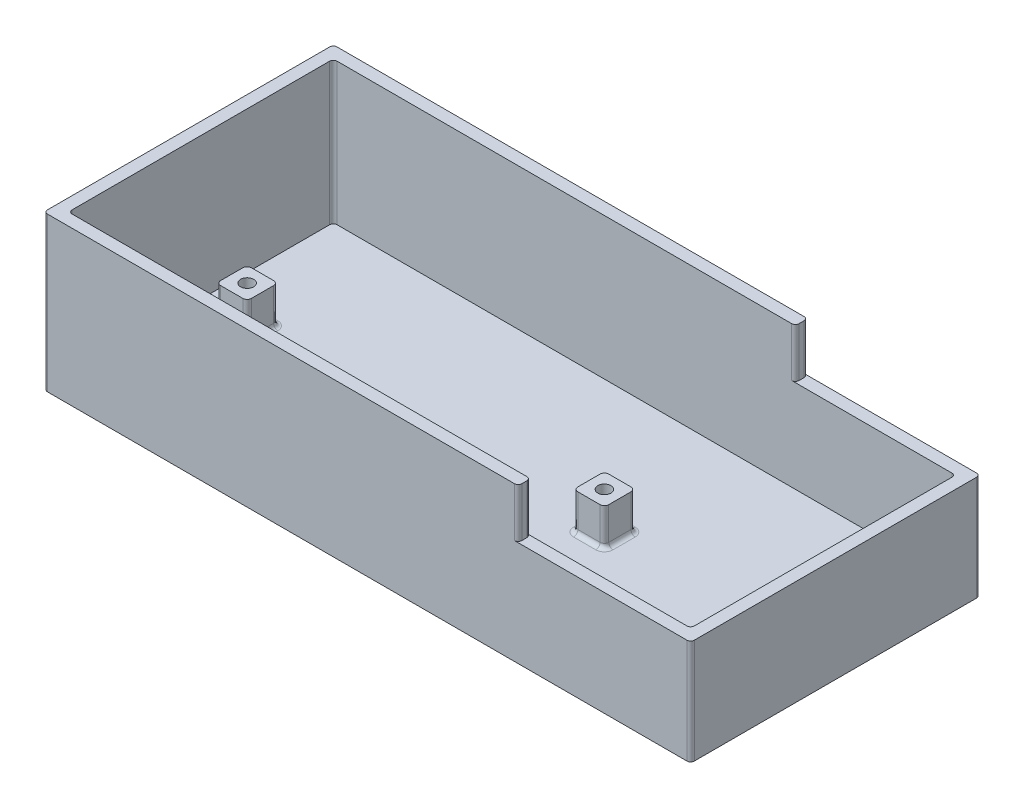
from build123d import *

# Parameters (mm, degrees)
SKETCH1_W           = 97.79
SKETCH1_H           = 59.69
BOSS_EXTRUDE1_DEPTH = 31.75
SHELL1_T            = -2.54
SKETCH2_W           = 6.35
SKETCH2_H           = 6.35
SKETCH2_R           = 1.35
BOSS_EXTRUDE2_DEPTH = 7.62
FILLET2_R           = 0.889
BOSS_EXTRUDE3_DEPTH = 35.56
SHELL2_START        = 2.54
SHELL2_OUTLINE_W    = 33.02
SHELL2_OUTLINE_H    = 54.61
SHELL2_DEPTH        = 19.05
FILLET3_R           = 0.762


# Read off the part's stored shape, not the designer's step: Shell2
with BuildPart() as part:
    # Sketch1 → Boss-Extrude1 (new body)
    with BuildSketch(Plane(origin=(0, 0, 0), x_dir=(1, 0, 0), z_dir=(0, 1, 0))):
        Rectangle(SKETCH1_W, SKETCH1_H)
    extrude(amount=BOSS_EXTRUDE1_DEPTH)

    # Shell1
    shell1_openings = [part.faces().sort_by_distance(p)[0] for p in [
        (0, 31.75, 0),
        (48.895, 15.875, 0),
    ]]
    offset(amount=SHELL1_T, openings=shell1_openings, kind=Kind.INTERSECTION)

    # Sketch2 → Boss-Extrude2 (add)
    # profile 1 of 2: a face of its own
    with BuildSketch(Plane(origin=(0, 2.54, 0), x_dir=(1, 0, 0), z_dir=(0, 1, 0))):
        with Locations((-36.83, 0)):
            Rectangle(SKETCH2_W, SKETCH2_H)
        with Locations(Location((-36.83, 0, 0), (0, 0, 90))):
            Circle(SKETCH2_R, mode=Mode.SUBTRACT)
    # profile 2 of 2: a face of its own
    with BuildSketch(Plane(origin=(0, 2.54, 0), x_dir=(1, 0, 0), z_dir=(0, 1, 0))):
        with Locations((36.83, 0)):
            Rectangle(SKETCH2_W, SKETCH2_H)
        with Locations(Location((36.83, 0, 0), (0, 0, 90))):
            Circle(SKETCH2_R, mode=Mode.SUBTRACT)
    extrude(amount=BOSS_EXTRUDE2_DEPTH)

    # Fillet2
    fillet2_edges = [part.edges().sort_by_distance(p)[0] for p in [
        (-33.655, 2.54, 0),
        (-33.655, 6.35, 3.175),
        (-36.83, 2.54, -3.175),
        (-33.655, 6.35, -3.175),
        (-40.005, 2.54, 0),
        (-40.005, 6.35, -3.175),
        (-36.83, 2.54, 3.175),
        (-40.005, 6.35, 3.175),
        (33.655, 2.54, 0),
        (33.655, 6.35, -3.175),
        (36.83, 2.54, 3.175),
        (33.655, 6.35, 3.175),
        (40.005, 2.54, 0),
        (40.005, 6.35, 3.175),
        (36.83, 2.54, -3.175),
        (40.005, 6.35, -3.175),
    ]]
    fillet(fillet2_edges, radius=FILLET2_R)

    # Sketch4 → Boss-Extrude3 (add)
    with BuildSketch(Plane(origin=(48.895, 0, 0), x_dir=(0, 0, -1), z_dir=(1, 0, 0))):
        Polygon((-29.845, 21.59), (-27.305, 21.59), (27.305, 21.59), (29.845, 21.59), (29.845, 0), (-29.845, 0), align=None)
    extrude(amount=BOSS_EXTRUDE3_DEPTH)

    # Shell2 outline → Shell2 (cut)
    with BuildSketch(Plane(origin=(0, 0, 0), x_dir=(1, 0, 0), z_dir=(0, 1, 0)).offset(SHELL2_START)):
        with Locations((65.405, 0)):
            Rectangle(SHELL2_OUTLINE_W, SHELL2_OUTLINE_H)
    extrude(amount=SHELL2_DEPTH, mode=Mode.SUBTRACT)

    # Fillet3
    fillet3_edges = [part.edges().sort_by_distance(p)[0] for p in [
        (84.455, 10.795, 29.845),
        (84.455, 10.795, -29.845),
        (81.915, 12.065, 27.305),
        (81.915, 12.065, -27.305),
        (-46.355, 17.145, -27.305),
        (-46.355, 17.145, 27.305),
        (48.895, 26.67, 27.305),
        (48.895, 26.67, -27.305),
        (-48.895, 15.875, -29.845),
        (48.895, 26.67, -29.845),
        (48.895, 26.67, 29.845),
        (-48.895, 15.875, 29.845),
    ]]
    fillet(fillet3_edges, radius=FILLET3_R)


solid = part.part
